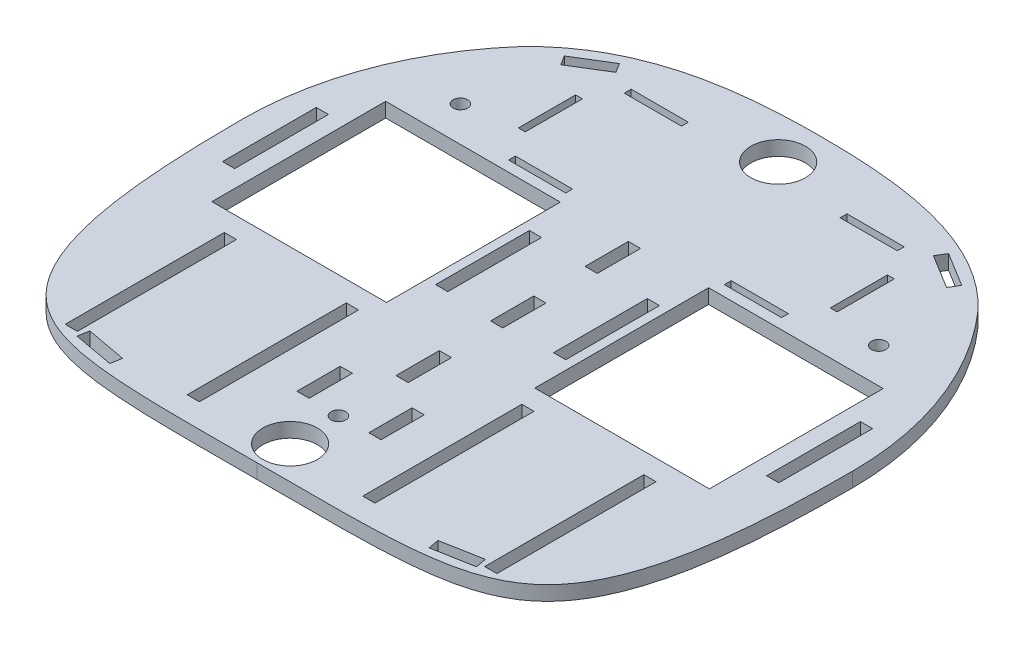
from build123d import *

# Parameters (mm, degrees)
BASE_DEPTH            = 6.35
SKETCH6_W             = 76.3515
SKETCH6_H             = 76
SKETCH6_W_2           = 5.334
SKETCH6_H_2           = 41.021
WHEELSHAFTCUT_DEPTH   = 189.692256213
SKETCH8_W             = 5.334
SKETCH8_H             = 69.573
SKETCH8_H_2           = 18.923
MOTORCUT_DEPTH        = 189.692256213
SKETCH10_W            = 25
SKETCH10_H            = 3
SKETCH10_W_2          = 3
SKETCH10_H_2          = 25
VELCROCUT_DEPTH       = 189.692256213
SKETCH11_R            = 3.175
SCREWCUT_DEPTH        = 189.692256213
SKETCH13_W            = 5.334
SKETCH13_H            = 18.923
SUPPORTSTRUTCUT_DEPTH = 189.692256213
EMPTYSPACETRIM_DEPTH  = 189.692256213
TAPESENSORCUT_DEPTH   = 185.275595127
SKETCH17_R            = 11.938
CASTERCUT_DEPTH       = 185.275595127


with BuildPart() as part:
    # Sketch1 → Base (new body)
    with BuildSketch(Plane(origin=(0, 0, 0), x_dir=(1, 0, 0), z_dir=(0, 1, 0))):
        with BuildLine():
            ThreePointArc((133.35, 0), (0, 133.35), (-133.35, 0))
            add(Edge.make_bspline(
                [(-133.35, 0), (-133.35, -51.197979728), (-123.803376308, -129.805052089), (-58.427993604, -127), (0, -127)],
                knots=[0, 0, 0, 0, 0.502616309, 1, 1, 1, 1], degree=3))
            add(Edge.make_bspline(
                [(133.35, 0), (133.35, -51.197979728), (123.803376308, -129.805052089), (58.427993604, -127), (0, -127)],
                knots=[0, 0, 0, 0, 0.502616309, 1, 1, 1, 1], degree=3))
        make_face()
    extrude(amount=BASE_DEPTH)

    # Sketch6 → WheelShaftCut (cut, through all)
    with BuildSketch(Plane(origin=(0, 6.35, 0), x_dir=(1, 0, 0), z_dir=(0, 1, 0))):
        with Locations((-70.592348141, 0)):
            Rectangle(SKETCH6_W, SKETCH6_H)
        with Locations((-118.959848141, 0)):
            Rectangle(SKETCH6_W_2, SKETCH6_H_2)
        with Locations((-25.780848141, 0)):
            Rectangle(SKETCH6_W_2, SKETCH6_H_2)
        with Locations((25.780848141, 0)):
            Rectangle(SKETCH6_W_2, SKETCH6_H_2)
        with Locations((118.959848141, 0)):
            Rectangle(SKETCH6_W_2, SKETCH6_H_2)
        with Locations((70.592348141, 0)):
            Rectangle(SKETCH6_W, SKETCH6_H)
    extrude(amount=-WHEELSHAFTCUT_DEPTH, mode=Mode.SUBTRACT)

    # Sketch8 → MotorCut (cut, through all)
    with BuildSketch(Plane(origin=(0, 6.35, 0), x_dir=(1, 0, 0), z_dir=(0, 1, 0))):
        with Locations((-38.378348141, -81.74)):
            Rectangle(SKETCH8_W, SKETCH8_H)
        with Locations((-91.718348141, -81.74)):
            Rectangle(SKETCH8_W, SKETCH8_H)
        with Locations((15.718348141, -81.74)):
            Rectangle(SKETCH8_W, SKETCH8_H_2)
        with Locations((91.718348141, -81.74)):
            Rectangle(SKETCH8_W, SKETCH8_H)
        with Locations((38.378348141, -81.74)):
            Rectangle(SKETCH8_W, SKETCH8_H)
        with Locations((-15.718348141, -81.74)):
            Rectangle(SKETCH8_W, SKETCH8_H_2)
    extrude(amount=-MOTORCUT_DEPTH, mode=Mode.SUBTRACT)

    # Sketch10 → VelcroCut (cut, through all)
    with BuildSketch(Plane(origin=(0, 6.35, 0), x_dir=(1, 0, 0), z_dir=(0, 1, 0))):
        with Locations((-47.19, 44.12)):
            Rectangle(SKETCH10_W, SKETCH10_H)
        with Locations((-47.19, 94.745)):
            Rectangle(SKETCH10_W, SKETCH10_H)
        with Locations((-68.175, 69.4325)):
            Rectangle(SKETCH10_W_2, SKETCH10_H_2)
        with Locations((68.175, 69.4325)):
            Rectangle(SKETCH10_W_2, SKETCH10_H_2)
        with Locations((47.19, 94.745)):
            Rectangle(SKETCH10_W, SKETCH10_H)
        with Locations((47.19, 44.12)):
            Rectangle(SKETCH10_W, SKETCH10_H)
    extrude(amount=-VELCROCUT_DEPTH, mode=Mode.SUBTRACT)

    # Sketch11 → ScrewCut (cut, through all)
    with BuildSketch(Plane(origin=(0, 6.35, 0), x_dir=(1, 0, 0), z_dir=(0, 1, 0))):
        with Locations((0, -91.44)):
            Circle(SKETCH11_R)
        with Locations((-91.44, 53.34)):
            Circle(SKETCH11_R)
        with Locations((91.44, 53.34)):
            Circle(SKETCH11_R)
    extrude(amount=-SCREWCUT_DEPTH, mode=Mode.SUBTRACT)

    # Sketch13 → SupportStrutCut (cut, through all)
    with BuildSketch(Plane(origin=(0, 6.35, 0), x_dir=(1, 0, 0), z_dir=(0, 1, 0))):
        with Locations((0, 28.5385)):
            Rectangle(SKETCH13_W, SKETCH13_H)
        with Locations((0, -12.8)):
            Rectangle(SKETCH13_W, SKETCH13_H)
        with Locations((0, -54.1385)):
            Rectangle(SKETCH13_W, SKETCH13_H)
    extrude(amount=-SUPPORTSTRUTCUT_DEPTH, mode=Mode.SUBTRACT)

    # Sketch16 → EmptySpaceTrim (cut, through all)
    with BuildSketch(Plane(origin=(0, 6.35, 0), x_dir=(1, 0, 0), z_dir=(0, 1, 0))):
        with BuildLine():
            Line((-100.033122546, 133.35), (-100.033122546, 88.179345052))
            add(Edge.make_bspline(
                [(-100.033122546, 88.179345052), (-73.919529929, 115.91021885), (-34.972901221, 119.822808394), (0, 119.822808394)],
                knots=[0, 0, 0, 0, 1, 1, 1, 1], degree=3))
            add(Edge.make_bspline(
                [(100.033122546, 88.179345052), (73.919529929, 115.91021885), (34.972901221, 119.822808394), (0, 119.822808394)],
                knots=[0, 0, 0, 0, 1, 1, 1, 1], degree=3))
            Line((100.033122546, 88.179345052), (100.033122546, 133.35))
            Line((100.033122546, 133.35), (-100.033122546, 133.35))
        make_face()
    extrude(amount=-EMPTYSPACETRIM_DEPTH, mode=Mode.SUBTRACT)

    # Sketch15 → TapeSensorCut (cut, through all)
    with BuildSketch(Plane(origin=(0, 6.35, 0), x_dir=(1, 0, 0), z_dir=(0, 1, 0))):
        Polygon((-87.346843545, -118.396296281), (-69.820843545, -121.616839259), (-68.948631108, -116.870311953), (-86.474631108, -113.649768975), align=None)
        Polygon((-84.353230389, 90.117551381), (-69.417317646, 99.287021733), (-71.942244264, 103.3998093), (-86.878157007, 94.230338948), align=None)
        Polygon((86.878157007, 94.230338948), (71.942244264, 103.3998093), (69.417317646, 99.287021733), (84.353230389, 90.117551381), align=None)
        Polygon((86.474631108, -113.649768975), (68.948631108, -116.870311953), (69.820843545, -121.616839259), (87.346843545, -118.396296281), align=None)
    extrude(amount=-TAPESENSORCUT_DEPTH, mode=Mode.SUBTRACT)

    # Sketch17 → CasterCut (cut, through all)
    with BuildSketch(Plane(origin=(0, 6.35, 0), x_dir=(1, 0, 0), z_dir=(0, 1, 0))):
        with Locations((0, 100.834589665)):
            Circle(SKETCH17_R)
        with Locations((0, -112.562458365)):
            Circle(SKETCH17_R)
    extrude(amount=-CASTERCUT_DEPTH, mode=Mode.SUBTRACT)


solid = part.part
